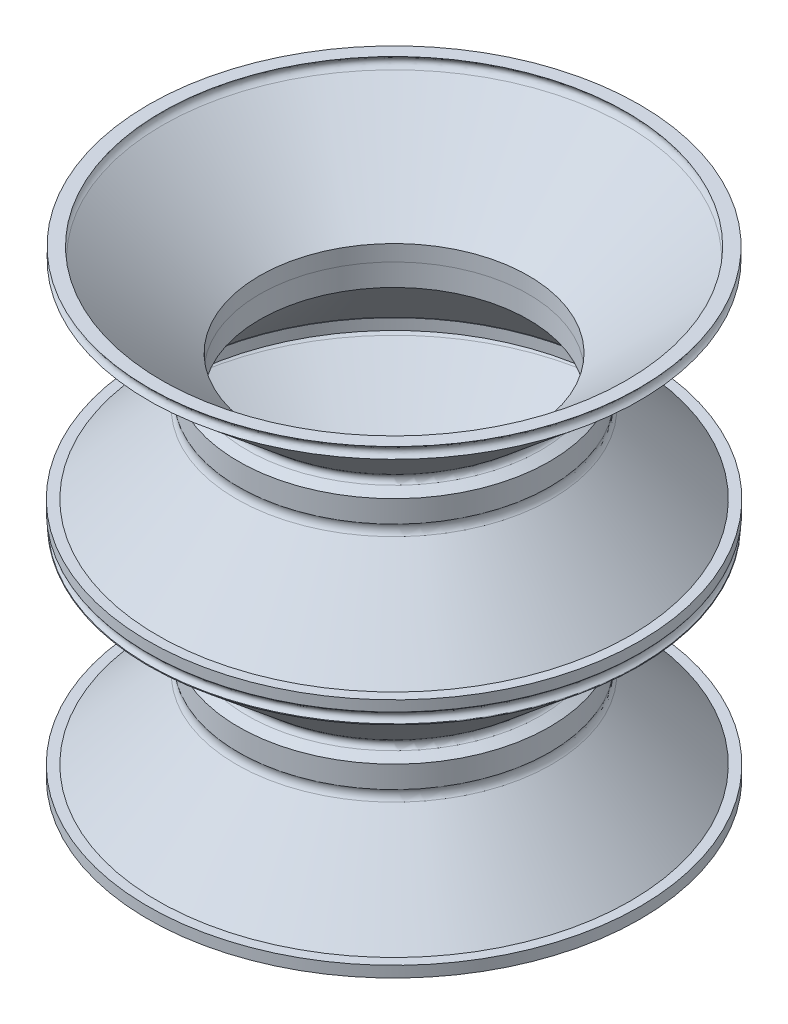
from build123d import *

# Parameters (mm, degrees)
ACTIVE_FILLET_R     = 0.5
SKETCH11_R          = 14.103676922
SKETCH11_R_2        = 12.180725781
COLLAR_DEPTH        = 2
PASSIVE_FILLET_R    = 0.8
SKETCH18_R          = 22.294579061
SKETCH18_R_2        = 20.130725781
BOSS_EXTRUDE4_DEPTH = 1
FILLET3_R           = 0.05
FILLET7_R           = 0.05


# Read off the part's stored shape, not the designer's step: Body-Move/Copy2
with BuildPart() as part:
    # Sketch1 → Main Active (revolve)
    with BuildSketch(Plane.XY):
        Polygon((-0.44430417, 0), (-9.978332911, 8), (-8.73375385, 8), (0.085520369, 0.599750256), (0.085520369, -0.848184734), (-1.837430772, -0.848184734), align=None)
    revolve(axis=Axis((12.26624615, 7.609018033, 0), (0, -1, 0)))

    # Active fillet
    active_fillet_edges = [part.edges().sort_by_distance(p)[0] for p in [
        (24.976796471, 0, 0),
    ]]
    fillet(active_fillet_edges, radius=ACTIVE_FILLET_R)

    # Sketch17 → Neck Curve (revolve)
    with BuildSketch(Plane.XY, mode=Mode.PRIVATE) as neck_curve_sk:
        with BuildLine():
            Line((-9.978332911, 8), (-8.73375385, 8))
            add(Edge.make_bspline(
                [(-8.73375385, 8), (-9.417134244, 8.454758025), (-8.796578829, 9)],
                knots=[0, 0, 0, 1, 1, 1], degree=2))
            Line((-8.796578829, 9), (-9.978332911, 9))
            add(Edge.make_bspline(
                [(-9.978332911, 8), (-9.322292514, 8.483356917), (-9.978332911, 9)],
                knots=[0, 0, 0, 1, 1, 1], degree=2))
        make_face()
    revolve(neck_curve_sk.sketch.rotate(Axis((12.26624615, -19.96984433, 0), (0, 1, 0)), 180), axis=Axis((12.26624615, -19.96984433, 0), (0, 1, 0)))

    # Fillet3
    fillet3_edges = [part.edges().sort_by_distance(p)[0] for p in [
        (12.26624615, 8, -22.244579061),
    ]]
    fillet(fillet3_edges, radius=FILLET3_R)


with BuildPart() as body_2:
    # Sketch11 → collar (new body)
    with BuildSketch(Plane.XZ.offset(0.848184734)):
        with Locations((12.26624615, 0)):
            Circle(SKETCH11_R)
        with Locations((12.26624615, 0)):
            Circle(SKETCH11_R_2, mode=Mode.SUBTRACT)
    extrude(amount=COLLAR_DEPTH)

    # Sketch14 → Passive Element (revolve)
    with BuildSketch(Plane.XY, mode=Mode.PRIVATE) as passive_element_sk:
        Polygon((-1.158987566, -2.848184734), (-9.158987566, -10.848184734), (-7.914479631, -10.848184734), (0.085520369, -2.848184734), align=None)
    revolve(passive_element_sk.sketch.rotate(Axis((12.26624615, -19.96984433, 0), (0, 1, 0)), 180), axis=Axis((12.26624615, -19.96984433, 0), (0, 1, 0)))

    # Passive Fillet
    # the kernel refuses this fillet: 0.8 mm, written as the material it adds along each edge
    with BuildSketch(Plane(origin=(12.26624615, -2.848184734, 0), x_dir=(1, 0, 0), z_dir=(0, 0, 1))) as passive_fillet_piece_1:
        with BuildLine():
            CenterArc((14.848517188, -0.291912621), PASSIVE_FILLET_R, 158.599138918, 66.400861082)
            Line((14.282831763, -0.857598046), (14.271518054, -0.868911755))
            Line((14.271518054, -0.868911755), (13.413920008, -0.011313708))
            Line((13.413920008, -0.011313708), (13.425233716, 0.016))
            ThreePointArc((13.425233716, 0.016), (13.764455319, 0.016), (14.088780117, 0.005838252))
            Line((14.088780117, 0.005838252), (14.103676922, 0))
        make_face()
    revolve(axis=Axis((12.26624615, -2.848184734, 0), (0, 1, 0)))

    # Sketch18 → Boss-Extrude4 (add)
    with BuildSketch(Plane.XZ.offset(10.848184734)):
        with Locations((12.26624615, 0)):
            Circle(SKETCH18_R)
        with Locations((12.26624615, 0)):
            Circle(SKETCH18_R_2, mode=Mode.SUBTRACT)
    extrude(amount=BOSS_EXTRUDE4_DEPTH)


with BuildPart() as body_3:
    # Body-Move/Copy2 outline → Body-Move/Copy2 (revolve)
    with BuildSketch(Plane(origin=(12.26624615, 0, 0), x_dir=(1, 0, 0), z_dir=(0, 0, 1))):
        with BuildLine():
            Line((14.103676922, 19.991815266), (13.305602068, 20.477711456))
            ThreePointArc((13.305602068, 20.477711456), (13.067048008, 20.867010025), (13.24422527, 21.287806453))
            Line((13.24422527, 21.287806453), (22.244579061, 28.84))
            add(Edge.make_bspline(
                [(22.244579061, 29.84), (21.588538664, 29.323356917), (22.244579061, 28.84)],
                knots=[0, 0, 0, 1, 1, 1], degree=2))
            Line((22.244579061, 29.84), (21.062824979, 29.84))
            add(Edge.make_bspline(
                [(21.062824979, 29.84), (21.683380394, 29.294758025), (21, 28.84)],
                knots=[0.048181037, 0.048181037, 0.048181037, 1.048181037, 1.048181037, 1.048181037], degree=2))
            Line((21, 28.84), (12.180725781, 21.439750256))
            Line((12.180725781, 21.439750256), (12.180725781, 19.991815266))
            Line((12.180725781, 19.991815266), (14.103676922, 19.991815266))
        make_face()
    revolve(axis=Axis((12.26624615, 0, 0), (0, 1, 0)))


with BuildPart() as body_4:
    # Body-Move_Copy2 2 outline → Body-Move_Copy2 2 (revolve)
    with BuildSketch(Plane(origin=(12.26624615, 0, 0), x_dir=(1, 0, 0), z_dir=(0, 0, 1))):
        with BuildLine():
            Line((14.103676922, 19.991815266), (12.180725781, 19.991815266))
            Line((12.180725781, 19.991815266), (12.180725781, 17.991815266))
            Line((12.180725781, 17.991815266), (20.180725781, 9.991815266))
            Line((20.180725781, 9.991815266), (20.130725781, 9.991815266))
            Line((20.130725781, 9.991815266), (20.130725781, 8.991815266))
            Line((20.130725781, 8.991815266), (22.294579061, 8.991815266))
            Line((22.294579061, 8.991815266), (22.294579061, 9.991815266))
            Line((22.294579061, 9.991815266), (21.425233716, 9.991815266))
            Line((21.425233716, 9.991815266), (14.282831763, 17.134217219))
            ThreePointArc((14.282831763, 17.134217219), (14.065422047, 17.536311687), (14.103676922, 17.991815266))
            Line((14.103676922, 17.991815266), (14.103676922, 19.991815266))
        make_face()
    revolve(axis=Axis((12.26624615, 0, 0), (0, 1, 0)))

    # Fillet7
    fillet7_edges = [body_4.edges().sort_by_distance(p)[0] for p in [
        (-10.028332911, 8.991815266, 0),
    ]]
    fillet(fillet7_edges, radius=FILLET7_R)


solid = Compound([part.part, body_2.part, body_3.part, body_4.part])
